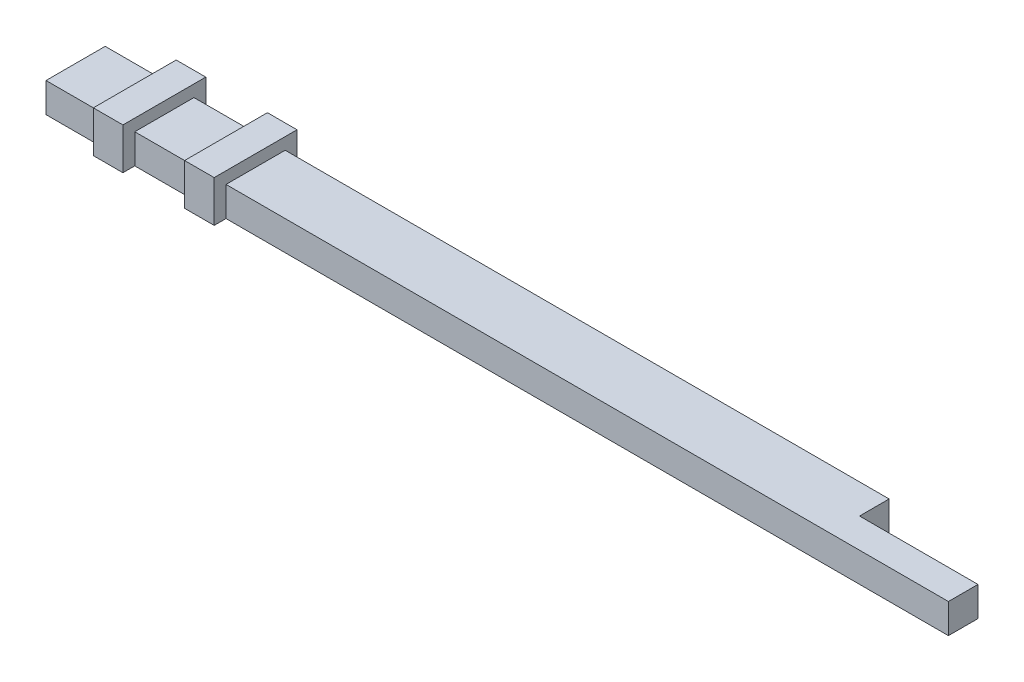
from build123d import *

# Parameters (mm, degrees)
BOSS_EXTRUDE1_DEPTH = 5
SKETCH2_W           = 14
SKETCH2_H           = 7
BOSS_EXTRUDE2_DEPTH = 5
SKETCH3_W           = 14
SKETCH3_H           = 7
BOSS_EXTRUDE3_DEPTH = 5


with BuildPart() as part:
    # Sketch1 → Boss-Extrude1 (new body)
    with BuildSketch(Plane(origin=(0, 0, 0), x_dir=(1, 0, 0), z_dir=(0, 1, 0))):
        Polygon((132.481495242, 10), (132.481495242, 5), (142.481495242, 5), (152.5, 5), (152.5, 0), (142.5, 0), (0, 0), (0, 10), align=None)
    extrude(amount=BOSS_EXTRUDE1_DEPTH)

    # Sketch2 → Boss-Extrude2 (add)
    with BuildSketch(Plane.ZY.offset(-10)):
        with Locations((-5, 3.5)):
            Rectangle(SKETCH2_W, SKETCH2_H)
    extrude(amount=-BOSS_EXTRUDE2_DEPTH)

    # Sketch3 → Boss-Extrude3 (add)
    with BuildSketch(Plane(origin=(30.42, 0, 0), x_dir=(0, 0, -1), z_dir=(1, 0, 0))):
        with Locations((5, 3.5)):
            Rectangle(SKETCH3_W, SKETCH3_H)
    extrude(amount=-BOSS_EXTRUDE3_DEPTH)


solid = part.part
